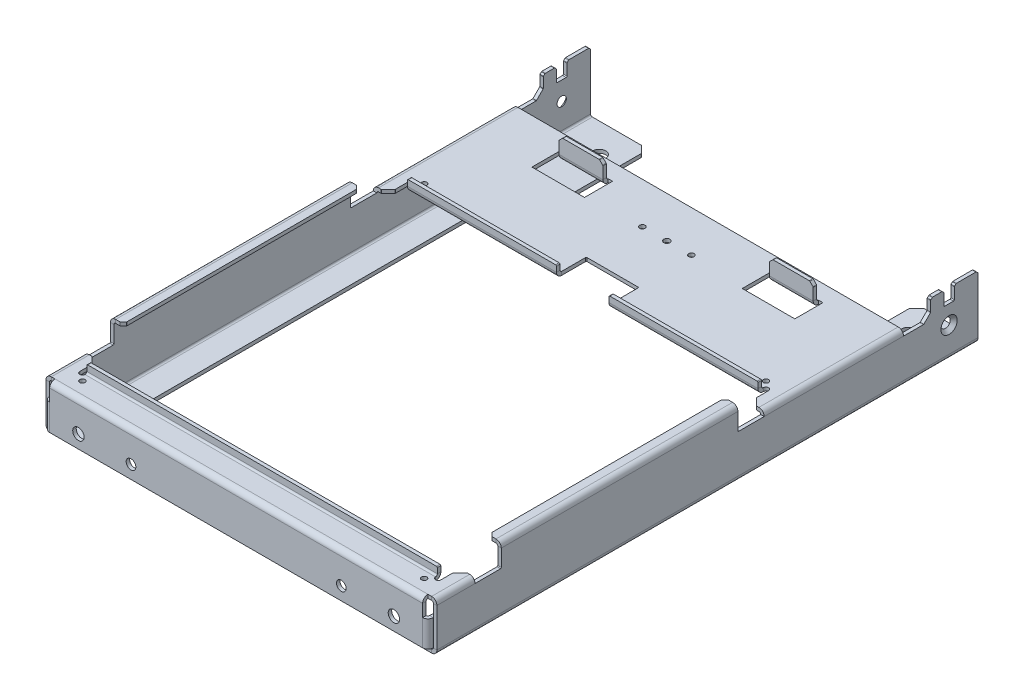
from build123d import *

# Parameters (mm, degrees)
SKETCH45_W                 = 217
SKETCH45_H                 = 308.75
BASE_FLANGE2_DEPTH         = 2
EDGE_FLANGE1_DEPTH         = 212.8
EDGE_FLANGE2_DEPTH         = 308.75
EDGE_FLANGE2_BEND_DEPTH    = 308.75
SKETCH77_R                 = 1.5
CUT_EXTRUDE8_DEPTH         = 199.254428087
SKETCH95_W                 = 42.5
SKETCH95_H                 = 3.016
CUT_EXTRUDE12_DEPTH        = 277.789221293
TAB2_START                 = -2
TAB2_OUTLINE_W             = 27
TAB2_OUTLINE_H             = 11.02
TAB2_DEPTH                 = 2
CUT_EXTRUDE13_DEPTH        = 199.254428087
CUT_EXTRUDE13_DEPTH_BACK   = 199.254428087
SKETCH96_R                 = 2.4
EDGE_FLANGE3_DEPTH         = 14.984
EDGE_FLANGE3_BEND_DEPTH    = 14.984
SKETCH126_W                = 165
SKETCH126_H                = 3.016
CUT_EXTRUDE14_DEPTH        = 25
TAB3_START                 = -2
TAB3_OUTLINE_W             = 135
TAB3_OUTLINE_H             = 10
TAB3_DEPTH                 = 2
EDGE_FLANGE4_START         = -25
EDGE_FLANGE4_DEPTH         = 135
CHAMFER1_SIZE              = 2
SKETCH133_W                = 30
SKETCH133_H                = 16
CUT_EXTRUDE15_DEPTH        = 2
EDGE_FLANGE5_DEPTH         = 25
EDGE_FLANGE5_BEND_DEPTH    = 25
CHAMFER2_SIZE              = 2
EDGE_FLANGE6_START         = -162
EDGE_FLANGE6_DEPTH         = 308.75
EDGE_FLANGE6_2_OUTLINE_W   = 18
EDGE_FLANGE6_2_OUTLINE_H   = 2
EDGE_FLANGE6_2_OUTLINE_W_2 = 16.5
EDGE_FLANGE6_2_DEPTH       = 65
EDGE_FLANGE6_START_2       = -28.016
EDGE_FLANGE6_3_DEPTH       = 2
SKETCH180_W                = 173.032
SKETCH180_H                = 165
CUT_EXTRUDE25_DEPTH        = 2
CHAMFER3_SIZE              = 4
CHAMFER4_SIZE              = 4
CUT_EXTRUDE16_DEPTH        = 199.657279031
CUT_EXTRUDE16_DEPTH_BACK   = 199.657279031
SKETCH143_W                = 6
SKETCH143_H                = 8
SKETCH144_R                = 3.625
CUT_EXTRUDE17_DEPTH        = 200.942417991
SKETCH151_R                = 2.75
SKETCH151_R_2              = 3.25
CUT_EXTRUDE19_DEPTH        = 10
CHAMFER5_SIZE              = 1
SKETCH152_W                = 30
SKETCH152_H                = 25
CUT_EXTRUDE20_DEPTH        = 199.657279031
SKETCH153_W                = 206
SKETCH153_H                = 11
CUT_EXTRUDE21_DEPTH        = 2
EDGE_FLANGE9_START         = -100
EDGE_FLANGE9_DEPTH         = 200
EDGE_FLANGE9_2_DEPTH       = 85
EDGE_FLANGE9_START_2       = 15
EDGE_FLANGE9_3_DEPTH       = 85
SKETCH166_R                = 1.75
SKETCH166_R_2              = 1.55
CUT_EXTRUDE23_DEPTH        = 199.657279031
CHAMFER6_SIZE              = 4
CUT_EXTRUDE26_REACH        = 200.657
SKETCH200_W                = 3
SKETCH200_H                = 1.5
FILLET3_R                  = 1.5
FILLET4_R                  = 1.5
FILLET5_R                  = 1.5
FILLET6_R                  = 1.5
FILLET7_R                  = 0.5
FILLET8_R                  = 0.5


with BuildPart() as part:
    # Base-Flange2: sheet metal written as solids
    # Sketch45 → Base-Flange2 (new body)
    with BuildSketch(Plane(origin=(0, 0, 0), x_dir=(1, 0, 0), z_dir=(0, 1, 0))):
        with Locations((0, 7.625)):
            Rectangle(SKETCH45_W, SKETCH45_H)
    extrude(amount=-BASE_FLANGE2_DEPTH)

    # Edge-Flange1: sheet metal written as solids
    # Edge-Flange1 section (on a plane across the edge) → Edge-Flange1 (add)
    with BuildSketch(Plane(origin=(106.4, -2, 147.766), x_dir=(0, 0, -1), z_dir=(-1, 0, 0))):
        with BuildLine():
            Line((-2, 1.016), (-2, 23))
            Line((-2, 23), (0, 23))
            Line((0, 23), (0, 1.016))
            ThreePointArc((0, 1.016), (0.29757951, 0.29757951), (1.016, 0))
            Line((1.016, 0), (1.016, -2))
            ThreePointArc((1.016, -2), (-1.116634052, -1.116634052), (-2, 1.016))
        make_face()
    extrude(amount=EDGE_FLANGE1_DEPTH)

    # Edge-Flange2: sheet metal written as solids
    # Edge-Flange2 section (on a plane across the edge) → Edge-Flange2 (add)
    with BuildSketch(Plane(origin=(-109.516, -2, 146.75), x_dir=(1, 0, 0), z_dir=(0, 0, -1))):
        with BuildLine():
            Line((-2, 1.016), (-2, 23))
            Line((-2, 23), (0, 23))
            Line((0, 23), (0, 1.016))
            ThreePointArc((0, 1.016), (0.29757951, 0.29757951), (1.016, 0))
            Line((1.016, 0), (1.016, -2))
            ThreePointArc((1.016, -2), (-1.116634052, -1.116634052), (-2, 1.016))
        make_face()
    extrude(amount=EDGE_FLANGE2_DEPTH)

    # Edge-Flange2 section 2 (on a plane across the edge) → Edge-Flange2 bend (add)
    with BuildSketch(Plane(origin=(109.516, -2, -162), x_dir=(-1, 0, 0), z_dir=(0, 0, 1))):
        with BuildLine():
            Line((-2, 1.016), (-2, 23))
            Line((-2, 23), (0, 23))
            Line((0, 23), (0, 1.016))
            ThreePointArc((0, 1.016), (0.29757951, 0.29757951), (1.016, 0))
            Line((1.016, 0), (1.016, -2))
            ThreePointArc((1.016, -2), (-1.116634052, -1.116634052), (-2, 1.016))
        make_face()
    extrude(amount=EDGE_FLANGE2_BEND_DEPTH)

    # Sketch77 → Cut-Extrude8 (cut, through all)
    with BuildSketch(Plane(origin=(0, 0, 0), x_dir=(1, 0, 0), z_dir=(0, 1, 0))):
        with Locations(Location((-97.5, 55, 0), (0, 0, 270))):
            Circle(SKETCH77_R)
        with Locations(Location((-97.5, -140, 0), (0, 0, 270))):
            Circle(SKETCH77_R)
        with Locations(Location((97.5, -140, 0), (0, 0, 270))):
            Circle(SKETCH77_R)
        with Locations(Location((97.5, 55, 0), (0, 0, 270))):
            Circle(SKETCH77_R)
    extrude(amount=-CUT_EXTRUDE8_DEPTH, mode=Mode.SUBTRACT)

    # Sketch95 → Cut-Extrude12 (cut, through all)
    with BuildSketch(Plane.ZY.offset(111.516)):
        with Locations((-140.75, -1.508)):
            Rectangle(SKETCH95_W, SKETCH95_H)
    extrude(amount=-CUT_EXTRUDE12_DEPTH, mode=Mode.SUBTRACT)

    # Tab2: read off the stored shape, not the designer's step
    # Tab2 outline → Tab2 (add)
    with BuildSketch(Plane.ZY.offset(111.516).offset(TAB2_START)):
        with Locations((-148.5, 2.494)):
            Rectangle(TAB2_OUTLINE_W, TAB2_OUTLINE_H)
    tab2 = extrude(amount=TAB2_DEPTH)

    # Mirror2: Tab2 across plane
    add(tab2.mirror(Plane(origin=(0, 0, 0), x_dir=(0, 0, 1), z_dir=(1, 0, 0))))

    # Sketch96 → Cut-Extrude13 (cut, two sides: drawn at the far end of the back side and taken through both)
    with BuildSketch(Plane(origin=(0, 0, 0), x_dir=(0, 0, -1), z_dir=(1, 0, 0)).offset(-CUT_EXTRUDE13_DEPTH_BACK)):
        with Locations((145.5, -10.516)):
            Circle(SKETCH96_R)
        with Locations((145.5, 11.484)):
            Circle(SKETCH96_R)
    extrude(amount=CUT_EXTRUDE13_DEPTH + CUT_EXTRUDE13_DEPTH_BACK, mode=Mode.SUBTRACT)

    # Edge-Flange3: sheet metal written as solids
    # Edge-Flange3 section (on a plane across the edge) → Edge-Flange3 (add)
    with BuildSketch(Plane(origin=(-107.416, -25, 147.766), x_dir=(1, 0, 0), z_dir=(0, 1, 0))):
        with BuildLine():
            Line((-2, 1.016), (-2, 25))
            Line((-2, 25), (0, 25))
            Line((0, 25), (0, 1.016))
            ThreePointArc((0, 1.016), (0.29757951, 0.29757951), (1.016, 0))
            Line((1.016, 0), (1.016, -2))
            ThreePointArc((1.016, -2), (-1.116634052, -1.116634052), (-2, 1.016))
        make_face()
    extrude(amount=EDGE_FLANGE3_DEPTH)

    # Edge-Flange3 section 2 (on a plane across the edge) → Edge-Flange3 bend (add)
    with BuildSketch(Plane(origin=(107.416, -10.016, 147.766), x_dir=(-1, 0, 0), z_dir=(0, -1, 0))):
        with BuildLine():
            Line((-2, 1.016), (-2, 25))
            Line((-2, 25), (0, 25))
            Line((0, 25), (0, 1.016))
            ThreePointArc((0, 1.016), (0.29757951, 0.29757951), (1.016, 0))
            Line((1.016, 0), (1.016, -2))
            ThreePointArc((1.016, -2), (-1.116634052, -1.116634052), (-2, 1.016))
        make_face()
    extrude(amount=EDGE_FLANGE3_BEND_DEPTH)

    # Sketch126 → Cut-Extrude14 (cut)
    with BuildSketch(Plane(origin=(111.516, 0, 0), x_dir=(0, 0, -1), z_dir=(1, 0, 0))):
        with Locations((-42.5, -1.508)):
            Rectangle(SKETCH126_W, SKETCH126_H)
    cut_extrude14 = extrude(amount=-CUT_EXTRUDE14_DEPTH, mode=Mode.SUBTRACT)

    # Tab3: read off the stored shape, not the designer's step
    # Tab3 outline → Tab3 (add)
    with BuildSketch(Plane(origin=(111.516, 0, 0), x_dir=(0, 0, -1), z_dir=(1, 0, 0)).offset(TAB3_START)):
        with Locations((-42.5, 1.984)):
            Rectangle(TAB3_OUTLINE_W, TAB3_OUTLINE_H)
    tab3 = extrude(amount=TAB3_DEPTH)

    # Edge-Flange4: read off the stored shape, not the designer's step
    # Edge-Flange4 outline → Edge-Flange4 (add)
    with BuildSketch(Plane.XY.offset(EDGE_FLANGE4_START)):
        with BuildLine():
            ThreePointArc((111.516, 6.984), (110.632634052, 9.116634052), (108.5, 10))
            Line((108.5, 10), (104.1, 10))
            Line((104.1, 10), (104.1, 8))
            Line((104.1, 8), (108.5, 8))
            ThreePointArc((108.5, 8), (109.21842049, 7.70242049), (109.516, 6.984))
            Line((109.516, 6.984), (111.516, 6.984))
        make_face()
    edge_flange4 = extrude(amount=EDGE_FLANGE4_DEPTH)

    # Mirror3: Cut-Extrude14, Tab3, Edge-Flange4 across plane
    add(cut_extrude14.mirror(Plane(origin=(0, 0, 0), x_dir=(0, 0, 1), z_dir=(1, 0, 0))), mode=Mode.SUBTRACT)
    add(tab3.mirror(Plane(origin=(0, 0, 0), x_dir=(0, 0, 1), z_dir=(1, 0, 0))))
    add(edge_flange4.mirror(Plane(origin=(0, 0, 0), x_dir=(0, 0, 1), z_dir=(1, 0, 0))))

    # Chamfer1
    chamfer1_edges = [part.edges().sort_by_distance(p)[0] for p in [
        (104.1, 9, 110),
        (104.1, 9, -25),
        (-104.1, 9, -25),
        (-104.1, 9, 110),
    ]]
    chamfer(chamfer1_edges, length=CHAMFER1_SIZE)

    # Sketch133 → Cut-Extrude15 (cut)
    with BuildSketch(Plane(origin=(0, 0, 0), x_dir=(1, 0, 0), z_dir=(0, 1, 0))):
        with Locations((-60, 102)):
            Rectangle(SKETCH133_W, SKETCH133_H)
        with Locations((60, 102)):
            Rectangle(SKETCH133_W, SKETCH133_H)
    extrude(amount=-CUT_EXTRUDE15_DEPTH, mode=Mode.SUBTRACT)

    # Edge-Flange5: sheet metal written as solids
    # Edge-Flange5 section (on a plane across the edge) → Edge-Flange5 (add)
    with BuildSketch(Plane(origin=(-72.5, 0, -108.984), x_dir=(0, 0, -1), z_dir=(1, 0, 0))):
        with BuildLine():
            Line((-2, 1.016), (-2, 10))
            Line((-2, 10), (0, 10))
            Line((0, 10), (0, 1.016))
            ThreePointArc((0, 1.016), (0.29757951, 0.29757951), (1.016, 0))
            Line((1.016, 0), (1.016, -2))
            ThreePointArc((1.016, -2), (-1.116634052, -1.116634052), (-2, 1.016))
        make_face()
    extrude(amount=EDGE_FLANGE5_DEPTH)

    # Edge-Flange5 section 2 (on a plane across the edge) → Edge-Flange5 bend (add)
    with BuildSketch(Plane(origin=(47.5, 0, -108.984), x_dir=(0, 0, -1), z_dir=(1, 0, 0))):
        with BuildLine():
            Line((-2, 1.016), (-2, 10))
            Line((-2, 10), (0, 10))
            Line((0, 10), (0, 1.016))
            ThreePointArc((0, 1.016), (0.29757951, 0.29757951), (1.016, 0))
            Line((1.016, 0), (1.016, -2))
            ThreePointArc((1.016, -2), (-1.116634052, -1.116634052), (-2, 1.016))
        make_face()
    extrude(amount=EDGE_FLANGE5_BEND_DEPTH)

    # Chamfer2
    chamfer2_edges = [part.edges().sort_by_distance(p)[0] for p in [
        (-72.5, 10, -107.984),
        (-47.5, 10, -107.984),
        (47.5, 10, -107.984),
        (72.5, 10, -107.984),
    ]]
    chamfer(chamfer2_edges, length=CHAMFER2_SIZE)

    # Edge-Flange6: read off the stored shape, not the designer's step
    # Edge-Flange6 outline → Edge-Flange6 (add)
    with BuildSketch(Plane.XY.offset(EDGE_FLANGE6_START)):
        with BuildLine():
            ThreePointArc((-111.516, -25), (-110.632634052, -27.132634052), (-108.5, -28.016))
            Line((-108.5, -28.016), (-94.516, -28.016))
            Line((-94.516, -28.016), (-94.516, -26.016))
            Line((-94.516, -26.016), (-108.5, -26.016))
            ThreePointArc((-108.5, -26.016), (-109.21842049, -25.71842049), (-109.516, -25))
            Line((-109.516, -25), (-111.516, -25))
        make_face()
        with BuildLine():
            Line((93.016, -28.016), (108.5, -28.016))
            ThreePointArc((108.5, -28.016), (110.632634052, -27.132634052), (111.516, -25))
            Line((111.516, -25), (109.516, -25))
            ThreePointArc((109.516, -25), (109.21842049, -25.71842049), (108.5, -26.016))
            Line((108.5, -26.016), (93.016, -26.016))
            Line((93.016, -26.016), (93.016, -28.016))
        make_face()
    extrude(amount=EDGE_FLANGE6_DEPTH)

    # Edge-Flange6 2 outline → Edge-Flange6 2 (add)
    with BuildSketch(Plane.XY.offset(EDGE_FLANGE6_START)):
        with Locations((-85.516, -27.016)):
            Rectangle(EDGE_FLANGE6_2_OUTLINE_W, EDGE_FLANGE6_2_OUTLINE_H)
        with Locations((84.766, -27.016)):
            Rectangle(EDGE_FLANGE6_2_OUTLINE_W_2, EDGE_FLANGE6_2_OUTLINE_H)
    extrude(amount=EDGE_FLANGE6_2_DEPTH)

    # Edge-Flange6 3 outline → Edge-Flange6 3 (add)
    with BuildSketch(Plane(origin=(0, 0, 0), x_dir=(1, 0, 0), z_dir=(0, 1, 0)).offset(EDGE_FLANGE6_START_2)):
        Polygon((-94.516, 79), (-76.516, 97), (-94.516, 97), align=None)
        Polygon((76.516, 97), (93.016, 70.528023532), (93.016, 97), align=None)
    extrude(amount=EDGE_FLANGE6_3_DEPTH)

    # Sketch180 → Cut-Extrude25 (cut)
    with BuildSketch(Plane(origin=(0, 0, 0), x_dir=(1, 0, 0), z_dir=(0, 1, 0))):
        with Locations((0, -42.5)):
            Rectangle(SKETCH180_W, SKETCH180_H)
    extrude(amount=-CUT_EXTRUDE25_DEPTH, mode=Mode.SUBTRACT)

    # Chamfer3
    chamfer3_edges = [part.edges().sort_by_distance(p)[0] for p in [
        (-94.516, -27.016, 146.75),
        (-76.516, -27.016, -162),
        (76.516, -27.016, -162),
        (93.016, -27.016, 146.75),
    ]]
    chamfer(chamfer3_edges, length=CHAMFER3_SIZE)

    # Chamfer4
    chamfer4_edges = [part.edges().sort_by_distance(p)[0] for p in [
        (-110.516, -3.016, -135),
        (110.516, -3.016, -135),
    ]]
    chamfer(chamfer4_edges, length=CHAMFER4_SIZE)

    # Sketch143 → Cut-Extrude16 (cut, two sides: drawn at the far end of the back side and taken through both)
    with BuildSketch(Plane(origin=(0, 0, 0), x_dir=(0, 0, -1), z_dir=(1, 0, 0)).offset(-CUT_EXTRUDE16_DEPTH_BACK)):
        with Locations((145.5, 4.004)):
            Rectangle(SKETCH143_W, SKETCH143_H)
    extrude(amount=CUT_EXTRUDE16_DEPTH + CUT_EXTRUDE16_DEPTH_BACK, mode=Mode.SUBTRACT)

    # Sketch144 → Cut-Extrude17 (cut, through all)
    with BuildSketch(Plane(origin=(0, -26.016, 0), x_dir=(1, 0, 0), z_dir=(0, 1, 0))):
        with Locations(Location((-88, 145.5, 0), (0, 0, 180))):
            Circle(SKETCH144_R)
        with Locations((88, 145.5)):
            Circle(SKETCH144_R)
    extrude(amount=-CUT_EXTRUDE17_DEPTH, mode=Mode.SUBTRACT)

    # Sketch151 → Cut-Extrude19 (cut)
    with BuildSketch(Plane.XY.offset(149.766)):
        with Locations((-60, -17.508)):
            Circle(SKETCH151_R)
        with Locations((90, -17.508)):
            Circle(SKETCH151_R_2)
        with Locations((-90, -17.508)):
            Circle(SKETCH151_R_2)
        with Locations(Location((60, -17.508, 0), (0, 0, 90))):
            Circle(SKETCH151_R)
    extrude(amount=-CUT_EXTRUDE19_DEPTH, mode=Mode.SUBTRACT)

    # Chamfer5
    chamfer5_edges = [part.edges().sort_by_distance(p)[0] for p in [
        (-110.516, 8.004, -162),
        (-110.516, 8.004, -135),
        (110.516, 8.004, -135),
        (110.516, 8.004, -162),
        (110.516, 8.004, -148.5),
        (110.516, 8.004, -142.5),
        (-110.516, 8.004, -142.5),
        (-110.516, 8.004, -148.5),
    ]]
    chamfer(chamfer5_edges, length=CHAMFER5_SIZE)

    # Sketch152 → Cut-Extrude20 (cut, through all)
    with BuildSketch(Plane(origin=(0, 0, 0), x_dir=(1, 0, 0), z_dir=(0, 1, 0))):
        with Locations((0, 52.5)):
            Rectangle(SKETCH152_W, SKETCH152_H)
    extrude(amount=-CUT_EXTRUDE20_DEPTH, mode=Mode.SUBTRACT)

    # Sketch153 → Cut-Extrude21 (cut)
    with BuildSketch(Plane(origin=(0, 0, 0), x_dir=(1, 0, 0), z_dir=(0, 1, 0))):
        with Locations((0, -130.5)):
            Rectangle(SKETCH153_W, SKETCH153_H)
        with Locations((0, 45.5)):
            Rectangle(SKETCH153_W, SKETCH153_H)
    extrude(amount=-CUT_EXTRUDE21_DEPTH, mode=Mode.SUBTRACT)

    # Edge-Flange9: read off the stored shape, not the designer's step
    # Edge-Flange9 outline → Edge-Flange9 (add)
    with BuildSketch(Plane.YZ.offset(EDGE_FLANGE9_START)):
        with BuildLine():
            Line((4.5, 132.984), (4.5, 134.984))
            Line((4.5, 134.984), (1.016, 134.984))
            ThreePointArc((1.016, 134.984), (0.29757951, 135.28157951), (0, 136))
            Line((0, 136), (-2, 136))
            ThreePointArc((-2, 136), (-1.116634052, 133.867365948), (1.016, 132.984))
            Line((1.016, 132.984), (4.5, 132.984))
        make_face()
    extrude(amount=EDGE_FLANGE9_DEPTH)

    # Edge-Flange9 2 outline → Edge-Flange9 2 (add)
    with BuildSketch(Plane.YZ.offset(EDGE_FLANGE9_START)):
        with BuildLine():
            Line((4.5, -47.984), (1.016, -47.984))
            ThreePointArc((1.016, -47.984), (-1.116634052, -48.867365948), (-2, -51))
            Line((-2, -51), (0, -51))
            ThreePointArc((0, -51), (0.29757951, -50.28157951), (1.016, -49.984))
            Line((1.016, -49.984), (4.5, -49.984))
            Line((4.5, -49.984), (4.5, -47.984))
        make_face()
    extrude(amount=EDGE_FLANGE9_2_DEPTH)

    # Edge-Flange9 3 outline → Edge-Flange9 3 (add)
    with BuildSketch(Plane.YZ.offset(EDGE_FLANGE9_START_2)):
        with BuildLine():
            Line((4.5, -47.984), (1.016, -47.984))
            ThreePointArc((1.016, -47.984), (-1.116634052, -48.867365948), (-2, -51))
            Line((-2, -51), (0, -51))
            ThreePointArc((0, -51), (0.29757951, -50.28157951), (1.016, -49.984))
            Line((1.016, -49.984), (4.5, -49.984))
            Line((4.5, -49.984), (4.5, -47.984))
        make_face()
    extrude(amount=EDGE_FLANGE9_3_DEPTH)

    # Sketch160 → Cut-Revolve1 (revolve, cut)
    with BuildSketch(Plane(origin=(0, 0, -145.5), x_dir=(-1, 0, 0), z_dir=(0, 0, -1))):
        Polygon((-111.516, -10.52), (-111.516, -5.87), (-109.116, -8.27), (-109.116, -10.52), align=None)
    cut_revolve1 = revolve(axis=Axis((-14.259062689, -10.52, -145.5), (1, 0, 0)), mode=Mode.SUBTRACT)

    # Mirror6: Cut-Revolve1 across plane
    add(cut_revolve1.mirror(Plane(origin=(0, 0, 0), x_dir=(0, 0, 1), z_dir=(1, 0, 0))), mode=Mode.SUBTRACT)

    # Sketch166 → Cut-Extrude23 (cut, through all)
    with BuildSketch(Plane(origin=(0, 0, 0), x_dir=(1, 0, 0), z_dir=(0, 1, 0))):
        with Locations(Location((0, 96, 0), (0, 0, 270))):
            Circle(SKETCH166_R)
        with Locations(Location((-14, 96, 0), (0, 0, 270))):
            Circle(SKETCH166_R_2)
        with Locations(Location((14, 96, 0), (0, 0, 270))):
            Circle(SKETCH166_R_2)
    extrude(amount=-CUT_EXTRUDE23_DEPTH, mode=Mode.SUBTRACT)

    # Chamfer6
    chamfer6_edges = [part.edges().sort_by_distance(p)[0] for p in [
        (-108.416, -25, 122.766),
        (-108.416, -10.016, 122.766),
        (108.416, -10.016, 122.766),
        (108.416, -25, 122.766),
        (103, -1, 125),
        (-103, -1, 125),
        (103, -1, -40),
        (-103, -1, -40),
    ]]
    chamfer(chamfer6_edges, length=CHAMFER6_SIZE)

    # Sketch200 → Cut-Extrude26 (cut, up to next)
    with BuildSketch(Plane(origin=(0, 0, 0), x_dir=(1, 0, 0), z_dir=(0, 1, 0)), mode=Mode.PRIVATE) as cut_extrude26_sk1:
        with Locations((-101.5, 51.75)):
            Rectangle(SKETCH200_W, SKETCH200_H)
    cut_extrude26_tool1 = extrude(cut_extrude26_sk1.sketch, amount=-CUT_EXTRUDE26_REACH, mode=Mode.PRIVATE) & part.part
    # Sketch200 → Cut-Extrude26 (cut, up to next)
    with BuildSketch(Plane(origin=(0, 0, 0), x_dir=(1, 0, 0), z_dir=(0, 1, 0)), mode=Mode.PRIVATE) as cut_extrude26_sk2:
        with Locations((-101.5, -136.75)):
            Rectangle(SKETCH200_W, SKETCH200_H)
    cut_extrude26_tool2 = extrude(cut_extrude26_sk2.sketch, amount=-CUT_EXTRUDE26_REACH, mode=Mode.PRIVATE) & part.part
    # Sketch200 → Cut-Extrude26 (cut, up to next)
    with BuildSketch(Plane(origin=(0, 0, 0), x_dir=(1, 0, 0), z_dir=(0, 1, 0)), mode=Mode.PRIVATE) as cut_extrude26_sk3:
        with Locations((101.5, -136.75)):
            Rectangle(SKETCH200_W, SKETCH200_H)
    cut_extrude26_tool3 = extrude(cut_extrude26_sk3.sketch, amount=-CUT_EXTRUDE26_REACH, mode=Mode.PRIVATE) & part.part
    # Sketch200 → Cut-Extrude26 (cut, up to next)
    with BuildSketch(Plane(origin=(0, 0, 0), x_dir=(1, 0, 0), z_dir=(0, 1, 0)), mode=Mode.PRIVATE) as cut_extrude26_sk4:
        with Locations((101.5, 51.75)):
            Rectangle(SKETCH200_W, SKETCH200_H)
    cut_extrude26_tool4 = extrude(cut_extrude26_sk4.sketch, amount=-CUT_EXTRUDE26_REACH, mode=Mode.PRIVATE) & part.part
    add(cut_extrude26_tool1.solids().sort_by_distance((-101.5, 0, -51.75))[0], mode=Mode.SUBTRACT)
    add(cut_extrude26_tool2.solids().sort_by_distance((-101.5, 0, 136.75))[0], mode=Mode.SUBTRACT)
    add(cut_extrude26_tool3.solids().sort_by_distance((101.5, 0, 136.75))[0], mode=Mode.SUBTRACT)
    add(cut_extrude26_tool4.solids().sort_by_distance((101.5, 0, -51.75))[0], mode=Mode.SUBTRACT)

    # Fillet3
    fillet3_edges = [part.edges().sort_by_distance(p)[0] for p in [
        (-103, -1, -52.5),
        (-100, -1, -52.5),
    ]]
    fillet(fillet3_edges, radius=FILLET3_R - 0.0001)  # a hair under: the kernel refuses the full size

    # Fillet4
    # the kernel refuses this fillet: 1.5 mm, written as the material it adds along each edge
    with BuildSketch(Plane(origin=(100, 0, -52.5), x_dir=(1, 0, 0), z_dir=(0, -1, 0)), Plane(origin=(103, 0, -52.5), x_dir=(0, 0, 1), z_dir=(0, -1, 0))) as fillet4_piece_1:
        with BuildLine():
            CenterArc((FILLET4_R, FILLET4_R), FILLET4_R, 180, 90)
            Line((0, FILLET4_R), (0, 0))
            Line((0, 0), (FILLET4_R, 0))
        make_face()
    extrude(amount=2)

    # Fillet5
    # the kernel refuses this fillet: 1.5 mm, written as the material it adds along each edge
    with BuildSketch(Plane(origin=(-100, 0, 137.5), x_dir=(0, 0, -1), z_dir=(0, -1, 0)), Plane(origin=(-103, 0, 137.5), x_dir=(1, 0, 0), z_dir=(0, -1, 0))) as fillet5_piece_1:
        with BuildLine():
            CenterArc((FILLET5_R, -FILLET5_R), FILLET5_R, 90, 90)
            Line((0, -FILLET5_R), (0, 0))
            Line((0, 0), (FILLET5_R, 0))
        make_face()
    extrude(amount=2)

    # Fillet6
    fillet6_edges = [part.edges().sort_by_distance(p)[0] for p in [
        (103, -1, 137.5),
        (100, -1, 137.5),
    ]]
    fillet(fillet6_edges, radius=FILLET6_R - 0.0001)  # a hair under: the kernel refuses the full size

    # Fillet7
    fillet7_edges = [part.edges().sort_by_distance(p)[0] for p in [
        (-110.516, -3.016, -131),
        (-110.516, 0.984, -135),
        (110.516, 0.984, -135),
        (110.516, -3.016, -131),
        (-110.516, 0.004, -148.5),
        (110.516, 0.004, -148.5),
        (-110.516, 0.004, -142.5),
        (110.516, 0.004, -142.5),
        (-110.516, 7.004, -135),
        (-110.516, 8.004, -141.5),
        (-110.516, 8.004, -136),
        (110.516, 8.004, -141.5),
        (110.516, 8.004, -136),
        (110.516, 7.004, -135),
        (110.516, 8.004, -161),
        (110.516, 8.004, -149.5),
        (110.516, 7.004, -148.5),
        (110.516, 7.004, -142.5),
        (-110.516, 7.004, -142.5),
        (-110.516, 8.004, -161),
        (-110.516, 8.004, -149.5),
        (-110.516, 7.004, -148.5),
        (-110.516, 7.004, -162),
        (110.516, 7.004, -162),
    ]]
    fillet(fillet7_edges, radius=FILLET7_R)

    # Fillet8
    fillet8_edges = [part.edges().sort_by_distance(p)[0] for p in [
        (110.516, -3.016, 110),
        (110.516, -3.016, -25),
        (-110.516, -3.016, 110),
        (-110.516, -3.016, -25),
        (104.1, 9, 108),
        (104.1, 9, -23),
        (106.1, 9, -25),
        (106.1, 9, 110),
        (-106.1, 9, -25),
        (-104.1, 9, 108),
        (-104.1, 9, -23),
        (-106.1, 9, 110),
        (49.5, 10, -107.984),
        (70.5, 10, -107.984),
        (72.5, 8, -107.984),
        (47.5, 8, -107.984),
        (-70.5, 10, -107.984),
        (-49.5, 10, -107.984),
        (-47.5, 8, -107.984),
        (-72.5, 8, -107.984),
        (-76.516, -27.016, -97),
        (-94.516, -27.016, -79),
        (93.016, -27.016, -70.528023532),
        (76.516, -27.016, -97),
        (93.016, -27.016, 142.75),
        (97.016, -27.016, 146.75),
        (-98.516, -27.016, 146.75),
        (-94.516, -27.016, 142.75),
        (-76.516, -27.016, -158),
        (-80.516, -27.016, -162),
        (80.516, -27.016, -162),
        (76.516, -27.016, -158),
        (-15, -1, -65),
        (15, -1, -65),
        (-100, 4.5, -48.984),
        (-15, 4.5, -48.984),
        (15, 4.5, -48.984),
        (100, 4.5, -48.984),
        (100, 4.5, 133.984),
        (-100, 4.5, 133.984),
        (103, -1, -44),
        (107, -1, -40),
        (108.416, -14.016, 122.766),
        (108.416, -21, 122.766),
        (108.416, -25, 126.766),
        (108.416, -10.016, 126.766),
        (107, -1, 125),
        (103, -1, 129),
        (-108.416, -25, 126.766),
        (-108.416, -14.016, 122.766),
        (-108.416, -21, 122.766),
        (-108.416, -10.016, 126.766),
        (-107, -1, -40),
        (-103, -1, -44),
    ]]
    fillet(fillet8_edges, radius=FILLET8_R)


solid = part.part
